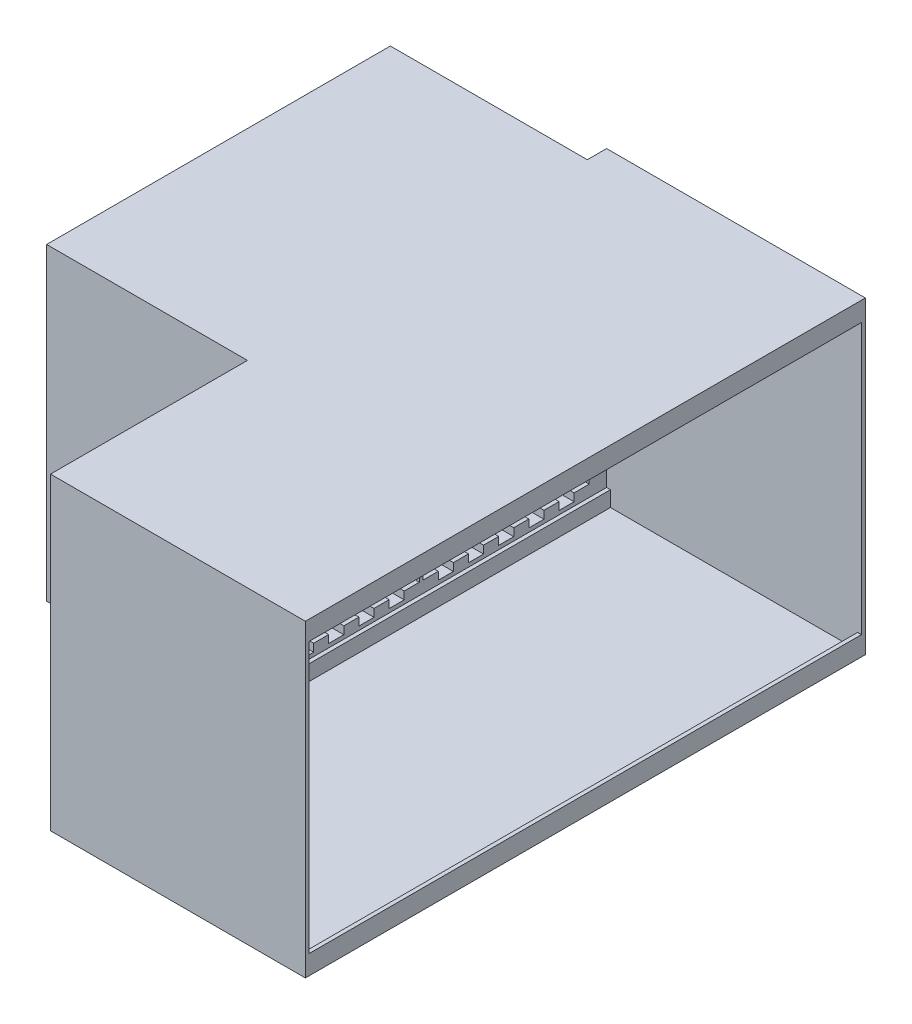
from build123d import *

# Parameters (mm, degrees)
SKETCH_3117_W                        = 940
SKETCH_3117_H                        = 800
EXTRUDE_3295_DEPTH                   = 1180
SKETCH_3336_W                        = 930
SKETCH_3336_H                        = 700
CUT_EXTRUDE_3395_DEPTH               = 660
SKETCH_3445_W                        = 430
SKETCH_3445_H                        = 320
CUT_EXTRUDE_3537_DEPTH               = 510
SKETCH_3588_W                        = 435
SKETCH_3588_H                        = 320
CUT_EXTRUDE_3645_DEPTH               = 10
SKETCH_3694_W                        = 640
SKETCH_3694_H                        = 930
CUT_EXTRUDE_4222_DEPTH               = 40
SKETCH_4271_W                        = 640
SKETCH_4271_H                        = 930
CUT_EXTRUDE_4402_DEPTH               = 40
SKETCH_4457_W                        = 39.090909091
SKETCH_4457_H                        = 20
CUT_EXTRUDE_4593_DEPTH               = 510
PATTERN_LINEAR_4647_COUNT            = 5
PATTERN_LINEAR_4647_PITCH            = 78.181818182
PATTERN_LINEAR_4715_COUNT            = 2
PATTERN_LINEAR_4715_PITCH            = 440
PATTERN_LINEAR_4715_COUNT_DIR2       = 2
PATTERN_LINEAR_4715_PITCH_DIR2       = 350
PATTERN_LINEAR_4715_COPY_1_SKETCH_W  = 39.090909091
PATTERN_LINEAR_4715_COPY_1_SKETCH_H  = 20
PATTERN_LINEAR_4715_COPY_1_DEPTH     = 510
PATTERN_LINEAR_4715_COPY_2_SKETCH_W  = 39.090909091
PATTERN_LINEAR_4715_COPY_2_SKETCH_H  = 20
PATTERN_LINEAR_4715_COPY_2_DEPTH     = 510
PATTERN_LINEAR_4715_COPY_3_SKETCH_W  = 39.090909091
PATTERN_LINEAR_4715_COPY_3_SKETCH_H  = 20
PATTERN_LINEAR_4715_COPY_3_DEPTH     = 510
PATTERN_LINEAR_4715_COPY_4_SKETCH_W  = 39.090909091
PATTERN_LINEAR_4715_COPY_4_SKETCH_H  = 20
PATTERN_LINEAR_4715_COPY_4_DEPTH     = 510
PATTERN_LINEAR_4715_COPY_5_SKETCH_W  = 39.090909091
PATTERN_LINEAR_4715_COPY_5_SKETCH_H  = 20
PATTERN_LINEAR_4715_COPY_5_DEPTH     = 510
PATTERN_LINEAR_4715_COPY_6_SKETCH_W  = 39.090909091
PATTERN_LINEAR_4715_COPY_6_SKETCH_H  = 20
PATTERN_LINEAR_4715_COPY_6_DEPTH     = 510
PATTERN_LINEAR_4715_COPY_7_SKETCH_W  = 39.090909091
PATTERN_LINEAR_4715_COPY_7_SKETCH_H  = 20
PATTERN_LINEAR_4715_COPY_7_DEPTH     = 510
PATTERN_LINEAR_4715_COPY_8_SKETCH_W  = 39.090909091
PATTERN_LINEAR_4715_COPY_8_SKETCH_H  = 20
PATTERN_LINEAR_4715_COPY_8_DEPTH     = 510
PATTERN_LINEAR_4715_COPY_9_SKETCH_W  = 39.090909091
PATTERN_LINEAR_4715_COPY_9_SKETCH_H  = 20
PATTERN_LINEAR_4715_COPY_9_DEPTH     = 510
PATTERN_LINEAR_4715_COPY_10_SKETCH_W = 39.090909091
PATTERN_LINEAR_4715_COPY_10_SKETCH_H = 20
PATTERN_LINEAR_4715_COPY_10_DEPTH    = 510
PATTERN_LINEAR_4715_COPY_11_SKETCH_W = 39.090909091
PATTERN_LINEAR_4715_COPY_11_SKETCH_H = 20
PATTERN_LINEAR_4715_COPY_11_DEPTH    = 510
PATTERN_LINEAR_4715_COPY_12_SKETCH_W = 39.090909091
PATTERN_LINEAR_4715_COPY_12_SKETCH_H = 20
PATTERN_LINEAR_4715_COPY_12_DEPTH    = 510
PATTERN_LINEAR_4715_COPY_13_SKETCH_W = 39.090909091
PATTERN_LINEAR_4715_COPY_13_SKETCH_H = 20
PATTERN_LINEAR_4715_COPY_13_DEPTH    = 510
PATTERN_LINEAR_4715_COPY_14_SKETCH_W = 39.090909091
PATTERN_LINEAR_4715_COPY_14_SKETCH_H = 20
PATTERN_LINEAR_4715_COPY_14_DEPTH    = 510
PATTERN_LINEAR_4715_COPY_15_SKETCH_W = 39.090909091
PATTERN_LINEAR_4715_COPY_15_SKETCH_H = 20
PATTERN_LINEAR_4715_COPY_15_DEPTH    = 510
EXTRUDE_5357_DEPTH                   = 500
SKETCH_5438_W                        = 660
SKETCH_5438_H                        = 800
EXTRUDE_5597_DEPTH                   = 10
SKETCH_14_W                          = 510
SKETCH_14_H                          = 800
CUT_EXTRUDE_1_DEPTH                  = 50


with BuildPart() as part:
    # Sketch 3117 → Extrude 3295 (new body)
    with BuildSketch(Plane(origin=(0, 0, 0), x_dir=(0, 0, -1), z_dir=(1, 0, 0))):
        Rectangle(SKETCH_3117_W, SKETCH_3117_H)
    extrude(amount=EXTRUDE_3295_DEPTH)

    # Sketch 3336 → Cut-Extrude 3395 (cut)
    with BuildSketch(Plane(origin=(1180, 0, 0), x_dir=(0, 0, -1), z_dir=(1, 0, 0))):
        with Locations((-5, 0)):
            Rectangle(SKETCH_3336_W, SKETCH_3336_H)
    extrude(amount=-CUT_EXTRUDE_3395_DEPTH, mode=Mode.SUBTRACT)

    # Sketch 3445 → Cut-Extrude 3537 (cut)
    with BuildSketch(Plane(origin=(520, 0, 0), x_dir=(0, 0, -1), z_dir=(1, 0, 0))):
        with Locations((-240, 190)):
            Rectangle(SKETCH_3445_W, SKETCH_3445_H)
    cut_extrude_3537 = extrude(amount=-CUT_EXTRUDE_3537_DEPTH, mode=Mode.SUBTRACT)

    # Sketch 3588 → Cut-Extrude 3645 (cut)
    with BuildSketch(Plane.ZY):
        with Locations((242.5, 190)):
            Rectangle(SKETCH_3588_W, SKETCH_3588_H)
    cut_extrude_3645 = extrude(amount=-CUT_EXTRUDE_3645_DEPTH, mode=Mode.SUBTRACT)

    # Sketch 3694 → Cut-Extrude 4222 (cut)
    with BuildSketch(Plane(origin=(0, -350, 0), x_dir=(1, 0, 0), z_dir=(0, 1, 0))):
        with Locations((850, -5)):
            Rectangle(SKETCH_3694_W, SKETCH_3694_H)
    extrude(amount=-CUT_EXTRUDE_4222_DEPTH, mode=Mode.SUBTRACT)

    # Sketch 4271 → Cut-Extrude 4402 (cut)
    with BuildSketch(Plane.XZ.offset(-350)):
        with Locations((850, 5)):
            Rectangle(SKETCH_4271_W, SKETCH_4271_H)
    extrude(amount=-CUT_EXTRUDE_4402_DEPTH, mode=Mode.SUBTRACT)

    # Sketch 4457 → Cut-Extrude 4593 (cut)
    with BuildSketch(Plane(origin=(520, 0, 0), x_dir=(0, 0, -1), z_dir=(1, 0, 0))):
        with Locations((-396.363636364, 20)):
            Rectangle(SKETCH_4457_W, SKETCH_4457_H)
    cut_extrude_4593 = extrude(amount=-CUT_EXTRUDE_4593_DEPTH, mode=Mode.SUBTRACT)

    # Pattern Linear 4647: Cut-Extrude 4593 ×5
    with Locations(*[(0, 0, -i * PATTERN_LINEAR_4647_PITCH) for i in range(1, PATTERN_LINEAR_4647_COUNT)]):
        add(cut_extrude_4593, mode=Mode.SUBTRACT)

    # Pattern Linear 4715: Cut-Extrude 3537, Cut-Extrude 3645 2 × 2
    with Locations(*[(0, -j * PATTERN_LINEAR_4715_PITCH_DIR2, -i * PATTERN_LINEAR_4715_PITCH) for i in range(PATTERN_LINEAR_4715_COUNT) for j in range(PATTERN_LINEAR_4715_COUNT_DIR2) if (i, j) != (0, 0)]):
        add(cut_extrude_3537, mode=Mode.SUBTRACT)
        add(cut_extrude_3645, mode=Mode.SUBTRACT)

    # Pattern Linear 4715 copy 1 sketch → Pattern Linear 4715 copy 1 (cut)
    with BuildSketch(Plane(origin=(520, -350, -78.181818182), x_dir=(0, 0, -1), z_dir=(1, 0, 0))):
        with Locations((-396.363636364, 20)):
            Rectangle(PATTERN_LINEAR_4715_COPY_1_SKETCH_W, PATTERN_LINEAR_4715_COPY_1_SKETCH_H)
    extrude(amount=-PATTERN_LINEAR_4715_COPY_1_DEPTH, mode=Mode.SUBTRACT)

    # Pattern Linear 4715 copy 2 sketch → Pattern Linear 4715 copy 2 (cut)
    with BuildSketch(Plane(origin=(520, 0, -518.181818182), x_dir=(0, 0, -1), z_dir=(1, 0, 0))):
        with Locations((-396.363636364, 20)):
            Rectangle(PATTERN_LINEAR_4715_COPY_2_SKETCH_W, PATTERN_LINEAR_4715_COPY_2_SKETCH_H)
    extrude(amount=-PATTERN_LINEAR_4715_COPY_2_DEPTH, mode=Mode.SUBTRACT)

    # Pattern Linear 4715 copy 3 sketch → Pattern Linear 4715 copy 3 (cut)
    with BuildSketch(Plane(origin=(520, -350, -518.181818182), x_dir=(0, 0, -1), z_dir=(1, 0, 0))):
        with Locations((-396.363636364, 20)):
            Rectangle(PATTERN_LINEAR_4715_COPY_3_SKETCH_W, PATTERN_LINEAR_4715_COPY_3_SKETCH_H)
    extrude(amount=-PATTERN_LINEAR_4715_COPY_3_DEPTH, mode=Mode.SUBTRACT)

    # Pattern Linear 4715 copy 4 sketch → Pattern Linear 4715 copy 4 (cut)
    with BuildSketch(Plane(origin=(520, -350, -156.363636364), x_dir=(0, 0, -1), z_dir=(1, 0, 0))):
        with Locations((-396.363636364, 20)):
            Rectangle(PATTERN_LINEAR_4715_COPY_4_SKETCH_W, PATTERN_LINEAR_4715_COPY_4_SKETCH_H)
    extrude(amount=-PATTERN_LINEAR_4715_COPY_4_DEPTH, mode=Mode.SUBTRACT)

    # Pattern Linear 4715 copy 5 sketch → Pattern Linear 4715 copy 5 (cut)
    with BuildSketch(Plane(origin=(520, 0, -596.363636364), x_dir=(0, 0, -1), z_dir=(1, 0, 0))):
        with Locations((-396.363636364, 20)):
            Rectangle(PATTERN_LINEAR_4715_COPY_5_SKETCH_W, PATTERN_LINEAR_4715_COPY_5_SKETCH_H)
    extrude(amount=-PATTERN_LINEAR_4715_COPY_5_DEPTH, mode=Mode.SUBTRACT)

    # Pattern Linear 4715 copy 6 sketch → Pattern Linear 4715 copy 6 (cut)
    with BuildSketch(Plane(origin=(520, -350, -596.363636364), x_dir=(0, 0, -1), z_dir=(1, 0, 0))):
        with Locations((-396.363636364, 20)):
            Rectangle(PATTERN_LINEAR_4715_COPY_6_SKETCH_W, PATTERN_LINEAR_4715_COPY_6_SKETCH_H)
    extrude(amount=-PATTERN_LINEAR_4715_COPY_6_DEPTH, mode=Mode.SUBTRACT)

    # Pattern Linear 4715 copy 7 sketch → Pattern Linear 4715 copy 7 (cut)
    with BuildSketch(Plane(origin=(520, -350, -234.545454545), x_dir=(0, 0, -1), z_dir=(1, 0, 0))):
        with Locations((-396.363636364, 20)):
            Rectangle(PATTERN_LINEAR_4715_COPY_7_SKETCH_W, PATTERN_LINEAR_4715_COPY_7_SKETCH_H)
    extrude(amount=-PATTERN_LINEAR_4715_COPY_7_DEPTH, mode=Mode.SUBTRACT)

    # Pattern Linear 4715 copy 8 sketch → Pattern Linear 4715 copy 8 (cut)
    with BuildSketch(Plane(origin=(520, 0, -674.545454545), x_dir=(0, 0, -1), z_dir=(1, 0, 0))):
        with Locations((-396.363636364, 20)):
            Rectangle(PATTERN_LINEAR_4715_COPY_8_SKETCH_W, PATTERN_LINEAR_4715_COPY_8_SKETCH_H)
    extrude(amount=-PATTERN_LINEAR_4715_COPY_8_DEPTH, mode=Mode.SUBTRACT)

    # Pattern Linear 4715 copy 9 sketch → Pattern Linear 4715 copy 9 (cut)
    with BuildSketch(Plane(origin=(520, -350, -674.545454545), x_dir=(0, 0, -1), z_dir=(1, 0, 0))):
        with Locations((-396.363636364, 20)):
            Rectangle(PATTERN_LINEAR_4715_COPY_9_SKETCH_W, PATTERN_LINEAR_4715_COPY_9_SKETCH_H)
    extrude(amount=-PATTERN_LINEAR_4715_COPY_9_DEPTH, mode=Mode.SUBTRACT)

    # Pattern Linear 4715 copy 10 sketch → Pattern Linear 4715 copy 10 (cut)
    with BuildSketch(Plane(origin=(520, -350, -312.727272727), x_dir=(0, 0, -1), z_dir=(1, 0, 0))):
        with Locations((-396.363636364, 20)):
            Rectangle(PATTERN_LINEAR_4715_COPY_10_SKETCH_W, PATTERN_LINEAR_4715_COPY_10_SKETCH_H)
    extrude(amount=-PATTERN_LINEAR_4715_COPY_10_DEPTH, mode=Mode.SUBTRACT)

    # Pattern Linear 4715 copy 11 sketch → Pattern Linear 4715 copy 11 (cut)
    with BuildSketch(Plane(origin=(520, 0, -752.727272727), x_dir=(0, 0, -1), z_dir=(1, 0, 0))):
        with Locations((-396.363636364, 20)):
            Rectangle(PATTERN_LINEAR_4715_COPY_11_SKETCH_W, PATTERN_LINEAR_4715_COPY_11_SKETCH_H)
    extrude(amount=-PATTERN_LINEAR_4715_COPY_11_DEPTH, mode=Mode.SUBTRACT)

    # Pattern Linear 4715 copy 12 sketch → Pattern Linear 4715 copy 12 (cut)
    with BuildSketch(Plane(origin=(520, -350, -752.727272727), x_dir=(0, 0, -1), z_dir=(1, 0, 0))):
        with Locations((-396.363636364, 20)):
            Rectangle(PATTERN_LINEAR_4715_COPY_12_SKETCH_W, PATTERN_LINEAR_4715_COPY_12_SKETCH_H)
    extrude(amount=-PATTERN_LINEAR_4715_COPY_12_DEPTH, mode=Mode.SUBTRACT)

    # Pattern Linear 4715 copy 13 sketch → Pattern Linear 4715 copy 13 (cut)
    with BuildSketch(Plane(origin=(520, -350, 0), x_dir=(0, 0, -1), z_dir=(1, 0, 0))):
        with Locations((-396.363636364, 20)):
            Rectangle(PATTERN_LINEAR_4715_COPY_13_SKETCH_W, PATTERN_LINEAR_4715_COPY_13_SKETCH_H)
    extrude(amount=-PATTERN_LINEAR_4715_COPY_13_DEPTH, mode=Mode.SUBTRACT)

    # Pattern Linear 4715 copy 14 sketch → Pattern Linear 4715 copy 14 (cut)
    with BuildSketch(Plane(origin=(520, 0, -440), x_dir=(0, 0, -1), z_dir=(1, 0, 0))):
        with Locations((-396.363636364, 20)):
            Rectangle(PATTERN_LINEAR_4715_COPY_14_SKETCH_W, PATTERN_LINEAR_4715_COPY_14_SKETCH_H)
    extrude(amount=-PATTERN_LINEAR_4715_COPY_14_DEPTH, mode=Mode.SUBTRACT)

    # Pattern Linear 4715 copy 15 sketch → Pattern Linear 4715 copy 15 (cut)
    with BuildSketch(Plane(origin=(520, -350, -440), x_dir=(0, 0, -1), z_dir=(1, 0, 0))):
        with Locations((-396.363636364, 20)):
            Rectangle(PATTERN_LINEAR_4715_COPY_15_SKETCH_W, PATTERN_LINEAR_4715_COPY_15_SKETCH_H)
    extrude(amount=-PATTERN_LINEAR_4715_COPY_15_DEPTH, mode=Mode.SUBTRACT)

    # Sketch 4787 → Extrude 5357 (add)
    with BuildSketch(Plane.XY.offset(470)):
        Polygon((1180, -400), (1180, -350), (1170, -350), (1170, -390), (530, -390), (530, -350), (520, -350), (520, -400), align=None)
        Polygon((1170, 350), (1180, 350), (1180, 400), (520, 400), (520, 350), (530, 350), (530, 390), (1170, 390), align=None)
    extrude(amount=EXTRUDE_5357_DEPTH)

    # Sketch 5438 → Extrude 5597 (add)
    with BuildSketch(Plane.XY.offset(970)):
        with Locations((850, 0)):
            Rectangle(SKETCH_5438_W, SKETCH_5438_H)
    extrude(amount=EXTRUDE_5597_DEPTH)

    # Эскиз14 → Вырез-Вытянуть1 (cut)
    with BuildSketch(Plane(origin=(0, 0, -470), x_dir=(-1, 0, 0), z_dir=(0, 0, -1))):
        with Locations((-255, 0)):
            Rectangle(SKETCH_14_W, SKETCH_14_H)
    extrude(amount=-CUT_EXTRUDE_1_DEPTH, mode=Mode.SUBTRACT)


solid = part.part
